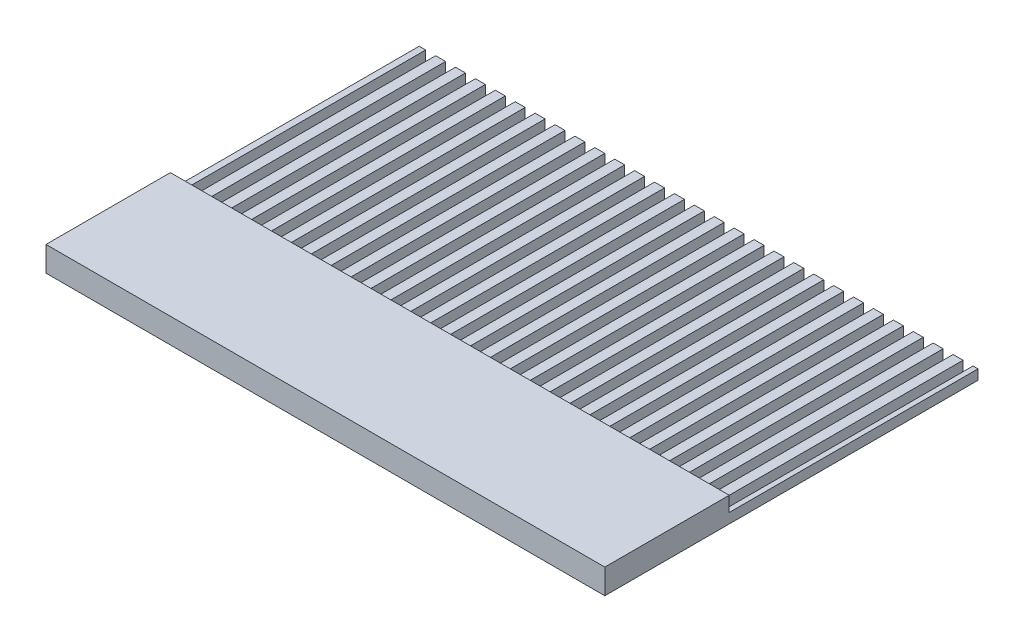
from build123d import *

# Parameters (mm, degrees)
SKETCH1_W           = 115
SKETCH1_H           = 15
BOSS_EXTRUDE1_DEPTH = 0.5
SKETCH2_W           = 115
SKETCH2_H           = 10
CUT_EXTRUDE1_DEPTH  = 0.1
SKETCH3_W           = 0.4
SKETCH3_H           = 10
CUT_EXTRUDE2_DEPTH  = 0.4
LPATTERN3_COUNT     = 150
LPATTERN3_PITCH     = 0.8
SKETCH4_W           = 115
SKETCH4_H           = 5
BOSS_EXTRUDE2_DEPTH = 1
SKETCH5_W           = 77.289086501
SKETCH5_H           = 15.822063322
CUT_EXTRUDE3_DEPTH  = 1
SKETCH6_W           = 3.197112069
SKETCH6_H           = 15.066627115
CUT_EXTRUDE4_DEPTH  = 1
SKETCH7_W           = 12.052245582
SKETCH7_H           = 15.126214191
CUT_EXTRUDE5_DEPTH  = 10


with BuildPart() as part:
    # Sketch1 → Boss-Extrude1 (new body)
    with BuildSketch(Plane(origin=(0, 0, 0), x_dir=(1, 0, 0), z_dir=(0, 1, 0))):
        with Locations((57.5, 7.5)):
            Rectangle(SKETCH1_W, SKETCH1_H)
    extrude(amount=BOSS_EXTRUDE1_DEPTH)

    # Sketch2 → Cut-Extrude1 (cut)
    with BuildSketch(Plane(origin=(0, 0.5, 0), x_dir=(1, 0, 0), z_dir=(0, 1, 0))):
        with Locations((57.5, 10)):
            Rectangle(SKETCH2_W, SKETCH2_H)
    extrude(amount=-CUT_EXTRUDE1_DEPTH, mode=Mode.SUBTRACT)

    # Sketch3 → Cut-Extrude2 (cut)
    with BuildSketch(Plane(origin=(0, 0.4, 0), x_dir=(1, 0, 0), z_dir=(0, 1, 0))):
        with Locations((0.2, 10)):
            Rectangle(SKETCH3_W, SKETCH3_H)
    cut_extrude2 = extrude(amount=-CUT_EXTRUDE2_DEPTH, mode=Mode.SUBTRACT)

    # LPattern3: Cut-Extrude2 ×150
    with Locations(*[(i * LPATTERN3_PITCH, 0, 0) for i in range(1, LPATTERN3_COUNT)]):
        add(cut_extrude2, mode=Mode.SUBTRACT)

    # Sketch4 → Boss-Extrude2 (add)
    with BuildSketch(Plane.XZ):
        with Locations((57.5, -2.5)):
            Rectangle(SKETCH4_W, SKETCH4_H)
    extrude(amount=-BOSS_EXTRUDE2_DEPTH)

    # Sketch5 → Cut-Extrude3 (cut)
    with BuildSketch(Plane(origin=(0, 1, 0), x_dir=(1, 0, 0), z_dir=(0, 1, 0))):
        with Locations((38.64454325, 7.911031661)):
            Rectangle(SKETCH5_W, SKETCH5_H)
    extrude(amount=-CUT_EXTRUDE3_DEPTH, mode=Mode.SUBTRACT)

    # Sketch6 → Cut-Extrude4 (cut)
    with BuildSketch(Plane(origin=(0, 1, 0), x_dir=(1, 0, 0), z_dir=(0, 1, 0))):
        with Locations((78.887642535, 7.533313558)):
            Rectangle(SKETCH6_W, SKETCH6_H)
    extrude(amount=-CUT_EXTRUDE4_DEPTH, mode=Mode.SUBTRACT)

    # Sketch7 → Cut-Extrude5 (cut)
    with BuildSketch(Plane(origin=(0, 1, 0), x_dir=(1, 0, 0), z_dir=(0, 1, 0))):
        with Locations((86.512321361, 7.563107096)):
            Rectangle(SKETCH7_W, SKETCH7_H)
    extrude(amount=-CUT_EXTRUDE5_DEPTH, mode=Mode.SUBTRACT)


solid = part.part
